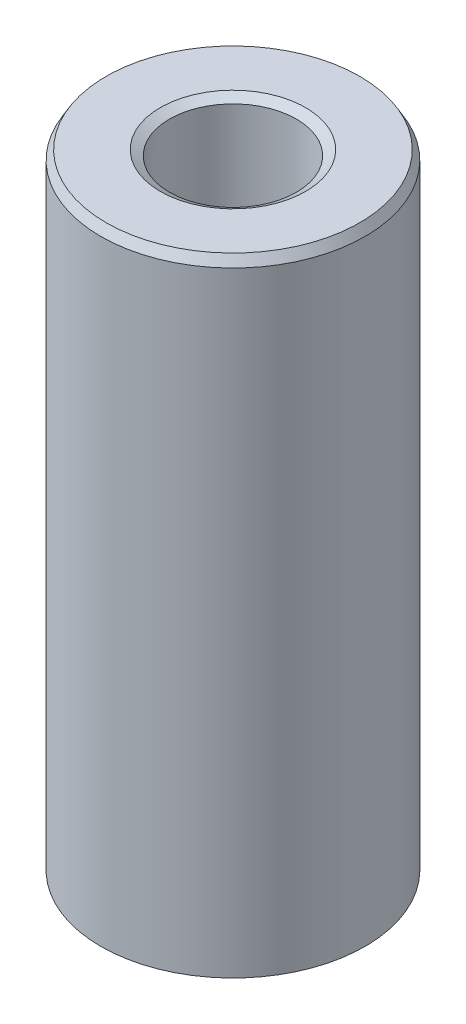
from build123d import *
from OCP.BRepFilletAPI import BRepFilletAPI_MakeChamfer

# Parameters (mm, degrees)
SKETCH1_R           = 35
BOSS_EXTRUDE1_DEPTH = 166.715926118
SKETCH2_R           = 16.805274852
CUT_EXTRUDE1_DEPTH  = 174.908596743
CHAMFER1_SIZE       = 2.442825337
CHAMFER1_SIZE2      = 1.410365866


with BuildPart() as part:
    # Sketch1 → Boss-Extrude1 (new body)
    with BuildSketch(Plane(origin=(0, 0, 0), x_dir=(1, 0, 0), z_dir=(0, 1, 0))):
        Circle(SKETCH1_R)
    extrude(amount=BOSS_EXTRUDE1_DEPTH)

    # Sketch2 → Cut-Extrude1 (cut, through all)
    with BuildSketch(Plane(origin=(0, 0, 0), x_dir=(1, 0, 0), z_dir=(0, 1, 0))):
        Circle(SKETCH2_R)
    extrude(amount=CUT_EXTRUDE1_DEPTH, mode=Mode.SUBTRACT)

    # Chamfer1: one chamfer whose edges measure the first distance from different faces: ONE call of the kernel's chamfer builder (chamfer() names one face for all edges)
    chamfer1_edges_1 = [part.edges().sort_by_distance(p)[0] for p in [
        (-16.805274852, 166.715926118, 0),
    ]]
    chamfer1_side_1 = [part.faces().sort_by_distance(p)[0] for p in [
        (-34.010050506, 166.715926118, 0),
    ]]
    chamfer1_edges_2 = [part.edges().sort_by_distance(p)[0] for p in [
        (-16.805274852, 0, 0),
    ]]
    chamfer1_side_2 = [part.faces().sort_by_distance(p)[0] for p in [
        (-16.805274852, 83.357963059, 0),
    ]]
    chamfer1_edges_3 = [part.edges().sort_by_distance(p)[0] for p in [
        (-35, 0, 0),
    ]]
    chamfer1_side_3 = [part.faces().sort_by_distance(p)[0] for p in [
        (-34.010050506, 0, 0),
    ]]
    chamfer1_edges_4 = [part.edges().sort_by_distance(p)[0] for p in [
        (-35, 166.715926118, 0),
    ]]
    chamfer1_side_4 = [part.faces().sort_by_distance(p)[0] for p in [
        (-35, 83.357963059, 0),
    ]]
    chamfer1 = BRepFilletAPI_MakeChamfer(part.part.solid().wrapped)
    for e in chamfer1_edges_1:
        chamfer1.Add(CHAMFER1_SIZE, CHAMFER1_SIZE2, e.wrapped, chamfer1_side_1[0].wrapped)  # the first distance lies on this face
    for e in chamfer1_edges_2:
        chamfer1.Add(CHAMFER1_SIZE, CHAMFER1_SIZE2, e.wrapped, chamfer1_side_2[0].wrapped)  # the first distance lies on this face
    for e in chamfer1_edges_3:
        chamfer1.Add(CHAMFER1_SIZE, CHAMFER1_SIZE2, e.wrapped, chamfer1_side_3[0].wrapped)  # the first distance lies on this face
    for e in chamfer1_edges_4:
        chamfer1.Add(CHAMFER1_SIZE, CHAMFER1_SIZE2, e.wrapped, chamfer1_side_4[0].wrapped)  # the first distance lies on this face
    add(Compound.cast(chamfer1.Shape()), mode=Mode.REPLACE)


solid = part.part
